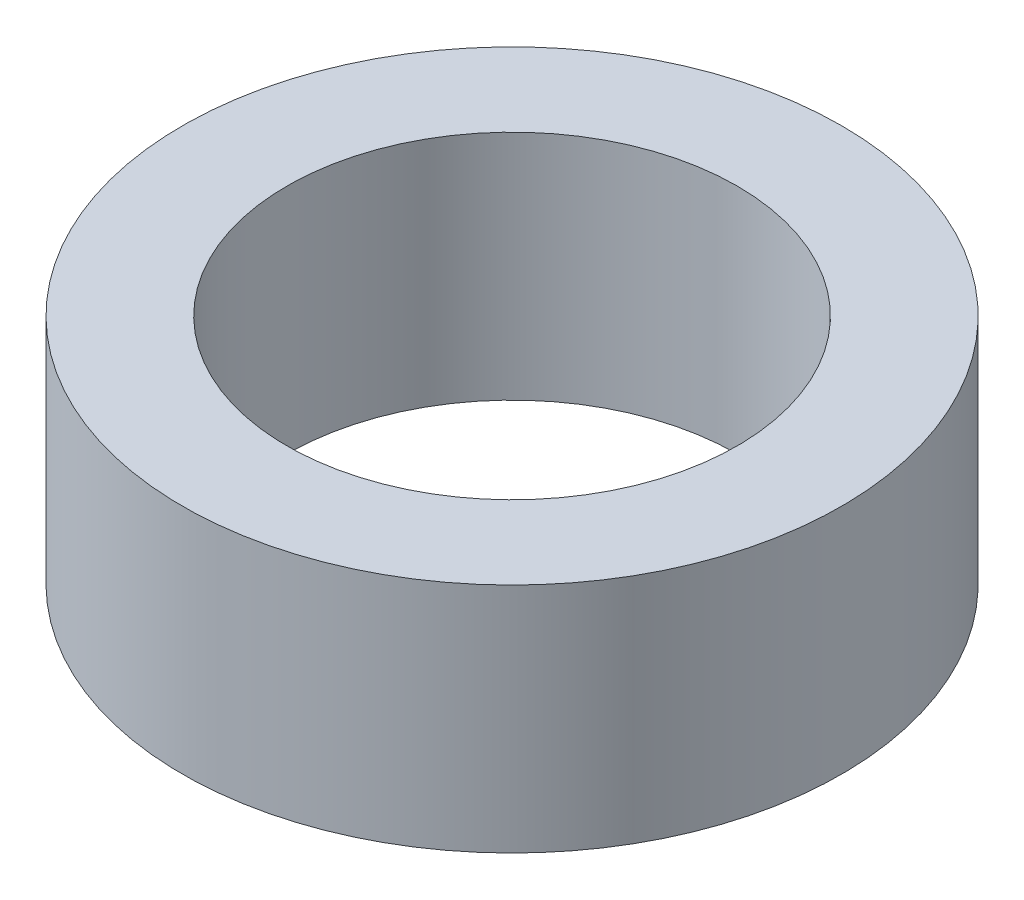
from build123d import *

# Parameters (mm, degrees)
SCHIZZO1_W = 22.5
SCHIZZO1_H = 50


with BuildPart() as part:
    # Schizzo1 → Rivoluzione1 (revolve)
    with BuildSketch(Plane.XY):
        with Locations((-59.75, 25)):
            Rectangle(SCHIZZO1_W, SCHIZZO1_H)
    revolve(axis=Axis((0, 0, 0), (0, 1, 0)))


solid = part.part
